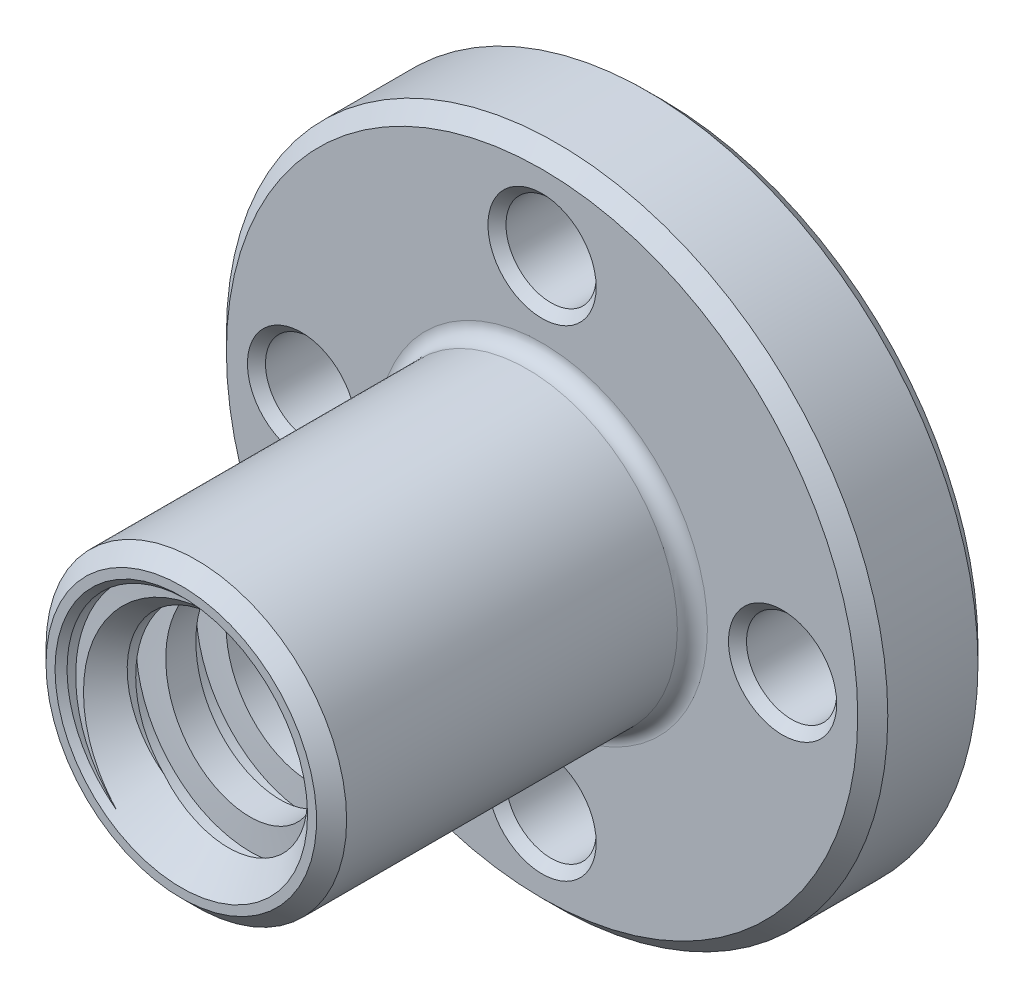
from build123d import *

# Parameters (mm, degrees)
SKETCH_1_R           = 11
EXTRUDE_1_DEPTH      = 4
EXTRUDE_2_DEPTH      = 2
EXTRUDE_2_DEPTH_BACK = 16
SKETCH_2_R           = 5
SKETCH_3_R           = 3
CUT_EXTRUDE_1_DEPTH  = 24.790754507
CHAMFER_1_SIZE       = 0.5
FILLET_1_R           = 0.5
CHAMFER_2_SIZE       = 1.2
SWEEP_1_PITCH        = 2
SKETCH_7_R           = 1.5
CUT_EXTRUDE_2_DEPTH  = 20.646882765
CHAMFER_3_SIZE       = 0.3


with BuildPart() as part:
    # Эскиз1 → Бобышка-Вытянуть1 (new body)
    with BuildSketch(Plane.XY):
        Circle(SKETCH_1_R)
    extrude(amount=EXTRUDE_1_DEPTH)

    # Эскиз2 → Бобышка-Вытянуть2 (add, two sides: drawn at the far end of the back side and taken through both)
    with BuildSketch(Plane(origin=(0, 0, 0), x_dir=(-1, 0, 0), z_dir=(0, 0, -1)).offset(-EXTRUDE_2_DEPTH_BACK)):
        Circle(SKETCH_2_R)
    extrude(amount=EXTRUDE_2_DEPTH + EXTRUDE_2_DEPTH_BACK)

    # Эскиз3 → Вырез-Вытянуть1 (cut, through all)
    with BuildSketch(Plane.XY.offset(16)):
        Circle(SKETCH_3_R)
    extrude(amount=-CUT_EXTRUDE_1_DEPTH, mode=Mode.SUBTRACT)

    # Фаска1
    chamfer_1_edges = [part.edges().sort_by_distance(p)[0] for p in [
        (-11, 0, 0),
        (-11, 0, 4),
        (5, 0, 16),
        (5, 0, -2),
    ]]
    chamfer(chamfer_1_edges, length=CHAMFER_1_SIZE)

    # Скругление1
    fillet_1_edges = [part.edges().sort_by_distance(p)[0] for p in [
        (5, 0, 4),
        (5, 0, 0),
    ]]
    fillet(fillet_1_edges, radius=FILLET_1_R)

    # Фаска2
    chamfer_2_edges = [part.edges().sort_by_distance(p)[0] for p in [
        (-3, 0, -2),
        (-3, 0, 16),
    ]]
    chamfer(chamfer_2_edges, length=CHAMFER_2_SIZE)

    # Вырез-По траектории1: the profile of Эскиз6 profile screwed along a right-hand helix of 11 turns, 10 arcs to a turn; built about Z, then put on its axis
    sweep_1_z = Axis((0, 0, 0), (0, 0, 1))
    sweep_1_corners = [(4, 0, 0.5), (2.9997, 0, 0.5), (2.9997, 0, -0.5), (4, 0, -0.5)]
    with BuildLine(mode=Mode.PRIVATE) as sweep_1_profile:
        Line(sweep_1_corners[0], sweep_1_corners[1])
        Line(sweep_1_corners[1], sweep_1_corners[2])
        Line(sweep_1_corners[2], sweep_1_corners[3])
        Line(sweep_1_corners[3], sweep_1_corners[0])
    sweep_1_cap = Face(sweep_1_profile.wire())
    sweep_1_turn_angles = [0, 18, 36, 54, 72, 90, 108, 126, 144, 162, 180, 198, 216, 234, 252, 270, 288, 306, 324, 342, 360]
    sweep_1_turn_weights = [1, 0.9510565162951535, 1, 0.9510565162951535, 1, 0.9510565162951535, 1, 0.9510565162951535, 1, 0.9510565162951535, 1, 0.9510565162951535, 1, 0.9510565162951535, 1, 0.9510565162951535, 1, 0.9510565162951535, 1, 0.9510565162951535, 1]
    sweep_1_turn_rails = [Edge.make_bspline([Vector(p[0], p[1], 0).rotate(sweep_1_z, sweep_1_turn_angles[k]) / sweep_1_turn_weights[k] + Vector(0, 0, p[2] + SWEEP_1_PITCH * sweep_1_turn_angles[k] / 360) for k in range(21)], [0, 0, 0, 1, 1, 2, 2, 3, 3, 4, 4, 5, 5, 6, 6, 7, 7, 8, 8, 9, 9, 10, 10, 10], 2, sweep_1_turn_weights) for p in sweep_1_corners]
    sweep_1_turn_sides = [Face.make_surface_from_curves(sweep_1_turn_rails[p[0]], sweep_1_turn_rails[p[1]]) for p in [(0, 1), (1, 2), (2, 3), (3, 0)]]
    sweep_1 = Plane(origin=(0, 0, 18), x_dir=(-1, 0, 0), z_dir=(0, 0, -1)) * Solid(Shell([*[p.moved(Location((0, 0, SWEEP_1_PITCH * i))) for i in range(11) for p in sweep_1_turn_sides], sweep_1_cap, sweep_1_cap.rotate(sweep_1_z, 3960).moved(Location((0, 0, SWEEP_1_PITCH * 3960 / 360)))]))
    add(sweep_1, mode=Mode.SUBTRACT)

    # Эскиз7 → Вырез-Вытянуть2 (cut, through all)
    with BuildSketch(Plane.XY.offset(4)):
        with Locations((0, 8)):
            Circle(SKETCH_7_R)
        with Locations((8, 0)):
            Circle(SKETCH_7_R)
        with Locations((0, -8)):
            Circle(SKETCH_7_R)
        with Locations((-8, 0)):
            Circle(SKETCH_7_R)
    extrude(amount=-CUT_EXTRUDE_2_DEPTH, mode=Mode.SUBTRACT)

    # Фаска3
    chamfer_3_edges = [part.edges().sort_by_distance(p)[0] for p in [
        (-1.5, 8, 0),
        (-1.5, 8, 4),
        (6.5, 0, 0),
        (6.5, 0, 4),
        (-1.5, -8, 0),
        (-1.5, -8, 4),
        (-9.5, 0, 0),
        (-9.5, 0, 4),
    ]]
    chamfer(chamfer_3_edges, length=CHAMFER_3_SIZE)


solid = part.part
